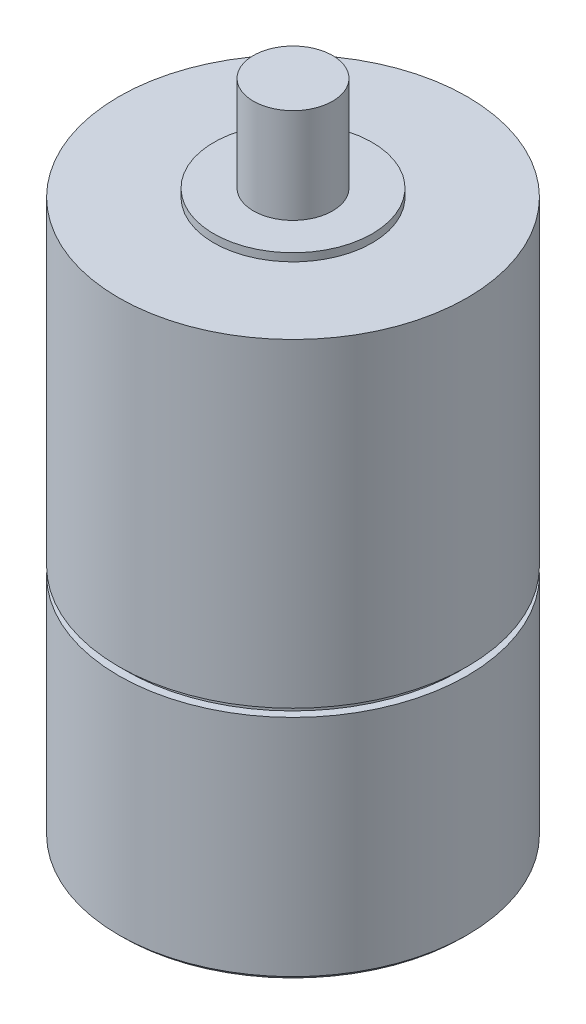
from build123d import *

# Parameters (mm, degrees)
CUT_EXTRUDE_1_DEPTH      = 23
CUT_EXTRUDE_1_DEPTH_BACK = 3
SKETCH_8_R               = 1.5
THREAD_2_PITCH           = 0.3175
SKETCH_9_R               = 5
CUT_EXTRUDE_2_DEPTH      = 15


with BuildPart() as part:
    # 扫描1: sweep along a path in 草图7
    with BuildLine(Plane(origin=(0, 20, 0), x_dir=(1, 0, 0), z_dir=(0, 1, 0))) as sweep_1_path:
        CenterArc((0, 0), 8.222167991, 0, 360)
    # 草图6 → 扫描1 (sweep)
    with BuildSketch(Plane.XY):
        Polygon((0, 0), (0, 98), (5, 98), (5, 73), (10, 73), (10, 72), (22, 72), (22, 31.681513685), (21, 31.681513685), (21, 30.681513685), (22, 30.681513685), (22, 2.337983279), (21.5, 1.837983279), (5, 1.837983279), (5, 0), align=None)
    sweep(path=sweep_1_path.line)

    # 草图8 → 切除-拉伸1 (cut, two sides: drawn at the far end of the back side and taken through both)
    with BuildSketch(Plane.XY.offset(-CUT_EXTRUDE_1_DEPTH_BACK)):
        with Locations(Location((0, 90.222635434, 0), (0, 0, 270))):
            Circle(SKETCH_8_R)
    extrude(amount=CUT_EXTRUDE_1_DEPTH + CUT_EXTRUDE_1_DEPTH_BACK, mode=Mode.SUBTRACT)

    # 螺纹线2: the profile of 螺纹线轮廓3 profile screwed along a right-hand helix of 23.622047 turns, 6 arcs to a turn; built about Z, then put on its axis
    thread_2_z = Axis((0, 0, 0), (0, 0, 1))
    thread_2_corners = [(1.5003, 0, -0.000173205), (1.5003, 0, 0.277985704), (1.328148085, 0, 0.17859375), (1.328148085, 0, 0.09921875)]
    with BuildLine(mode=Mode.PRIVATE) as thread_2_profile:
        Line(thread_2_corners[0], thread_2_corners[1])
        Line(thread_2_corners[1], thread_2_corners[2])
        Line(thread_2_corners[2], thread_2_corners[3])
        Line(thread_2_corners[3], thread_2_corners[0])
    thread_2_cap = Face(thread_2_profile.wire())
    thread_2_turn_angles = [0, 30, 60, 90, 120, 150, 180, 210, 240, 270, 300, 330, 360]
    thread_2_turn_weights = [1, 0.8660254037844387, 1, 0.8660254037844387, 1, 0.8660254037844387, 1, 0.8660254037844387, 1, 0.8660254037844387, 1, 0.8660254037844387, 1]
    thread_2_turn_rails = [Edge.make_bspline([Vector(p[0], p[1], 0).rotate(thread_2_z, thread_2_turn_angles[k]) / thread_2_turn_weights[k] + Vector(0, 0, p[2] + THREAD_2_PITCH * thread_2_turn_angles[k] / 360) for k in range(13)], [0, 0, 0, 1, 1, 2, 2, 3, 3, 4, 4, 5, 5, 6, 6, 6], 2, thread_2_turn_weights) for p in thread_2_corners]
    thread_2_turn_sides = [Face.make_surface_from_curves(thread_2_turn_rails[p[0]], thread_2_turn_rails[p[1]]) for p in [(0, 1), (1, 2), (2, 3), (3, 0)]]
    thread_2_last_angles = [8280, 8310, 8340, 8370, 8400, 8430, 8460, 8481.968503937, 8503.937007874]
    thread_2_last_weights = [1, 0.8660254037844387, 1, 0.8660254037844387, 1, 0.8660254037844387, 1, 0.9273896394584102, 1]
    thread_2_last_rails = [Edge.make_bspline([Vector(p[0], p[1], 0).rotate(thread_2_z, thread_2_last_angles[k]) / thread_2_last_weights[k] + Vector(0, 0, p[2] + THREAD_2_PITCH * thread_2_last_angles[k] / 360) for k in range(9)], [0, 0, 0, 1, 1, 2, 2, 3, 3, 4, 4, 4], 2, thread_2_last_weights) for p in thread_2_corners]
    thread_2_last_sides = [Face.make_surface_from_curves(thread_2_last_rails[p[0]], thread_2_last_rails[p[1]]) for p in [(0, 1), (1, 2), (2, 3), (3, 0)]]
    thread_2 = Plane(origin=(0, 90.222635434, -3), x_dir=(1, 0, 0), z_dir=(0, 0, 1)) * Solid(Shell([*[p.moved(Location((0, 0, THREAD_2_PITCH * i))) for i in range(23) for p in thread_2_turn_sides], *thread_2_last_sides, thread_2_cap, thread_2_cap.rotate(thread_2_z, 8503.937007874).moved(Location((0, 0, THREAD_2_PITCH * 8503.937007874 / 360)))]))
    add(thread_2)

    # 草图9 → 切除-拉伸2 (cut)
    with BuildSketch(Plane(origin=(0, 100, 0), x_dir=(1, 0, 0), z_dir=(0, 1, 0))):
        Circle(SKETCH_9_R)
    extrude(amount=-CUT_EXTRUDE_2_DEPTH, mode=Mode.SUBTRACT)


solid = part.part
